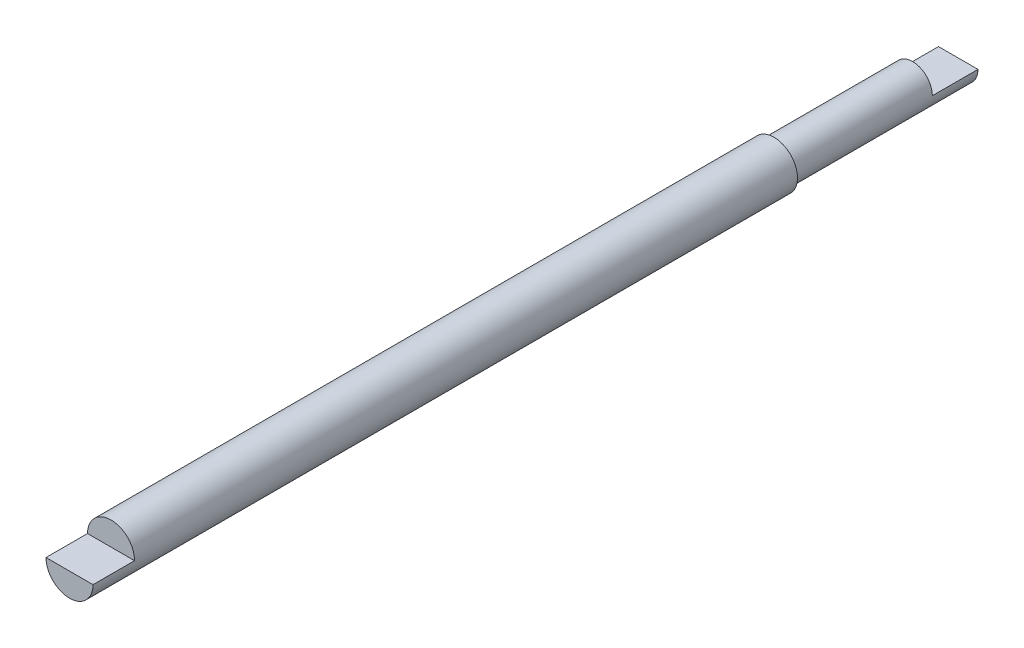
from build123d import *

# Parameters (mm, degrees)
SKETCH1_R           = 4.7625
BOSS_EXTRUDE1_DEPTH = 180
CUT_EXTRUDE1_START  = -8.41
CUT_EXTRUDE1_DEPTH  = 8.41
SKETCH3_R           = 4.7625
SKETCH3_R_2         = 4
CUT_EXTRUDE2_DEPTH  = 37.32
CUT_EXTRUDE3_DEPTH  = 9.25


with BuildPart() as part:
    # Sketch1 → Boss-Extrude1 (new body)
    with BuildSketch(Plane.XY):
        Circle(SKETCH1_R)
    extrude(amount=BOSS_EXTRUDE1_DEPTH)

    # Sketch2 → Cut-Extrude1 (cut)
    with BuildSketch(Plane.XY.offset(180).offset(CUT_EXTRUDE1_START)):
        with BuildLine():
            ThreePointArc((4.7625, 0), (0, 4.7625), (-4.7625, 0))
            Line((-4.7625, 0), (4.7625, 0))
        make_face()
    extrude(amount=CUT_EXTRUDE1_DEPTH, mode=Mode.SUBTRACT)

    # Sketch3 → Cut-Extrude2 (cut)
    with BuildSketch(Plane(origin=(0, 0, 0), x_dir=(-1, 0, 0), z_dir=(0, 0, -1))):
        Circle(SKETCH3_R)
        Circle(SKETCH3_R_2, mode=Mode.SUBTRACT)
    extrude(amount=-CUT_EXTRUDE2_DEPTH, mode=Mode.SUBTRACT)

    # Sketch4 → Cut-Extrude3 (cut)
    with BuildSketch(Plane(origin=(0, 0, 0), x_dir=(-1, 0, 0), z_dir=(0, 0, -1))):
        with BuildLine():
            ThreePointArc((4, 0), (0, 4), (-4, 0))
            Line((-4, 0), (4, 0))
        make_face()
    extrude(amount=-CUT_EXTRUDE3_DEPTH, mode=Mode.SUBTRACT)


solid = part.part
